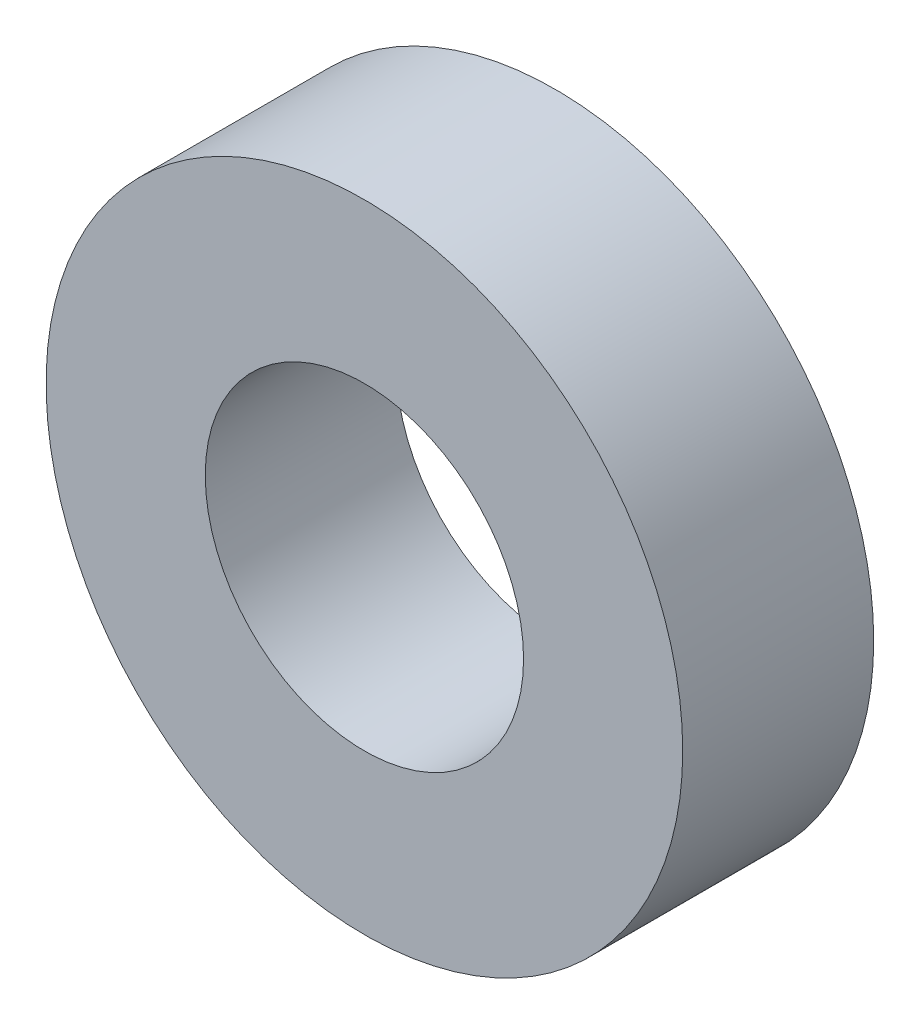
from build123d import *

# Parameters (mm, degrees)
SKETCH1_R           = 5
SKETCH1_R_2         = 2.5
BOSS_EXTRUDE1_DEPTH = 3


with BuildPart() as part:
    # Sketch1 → Boss-Extrude1 (new body)
    with BuildSketch(Plane.XY):
        Circle(SKETCH1_R)
        Circle(SKETCH1_R_2, mode=Mode.SUBTRACT)
    extrude(amount=BOSS_EXTRUDE1_DEPTH)


solid = part.part
